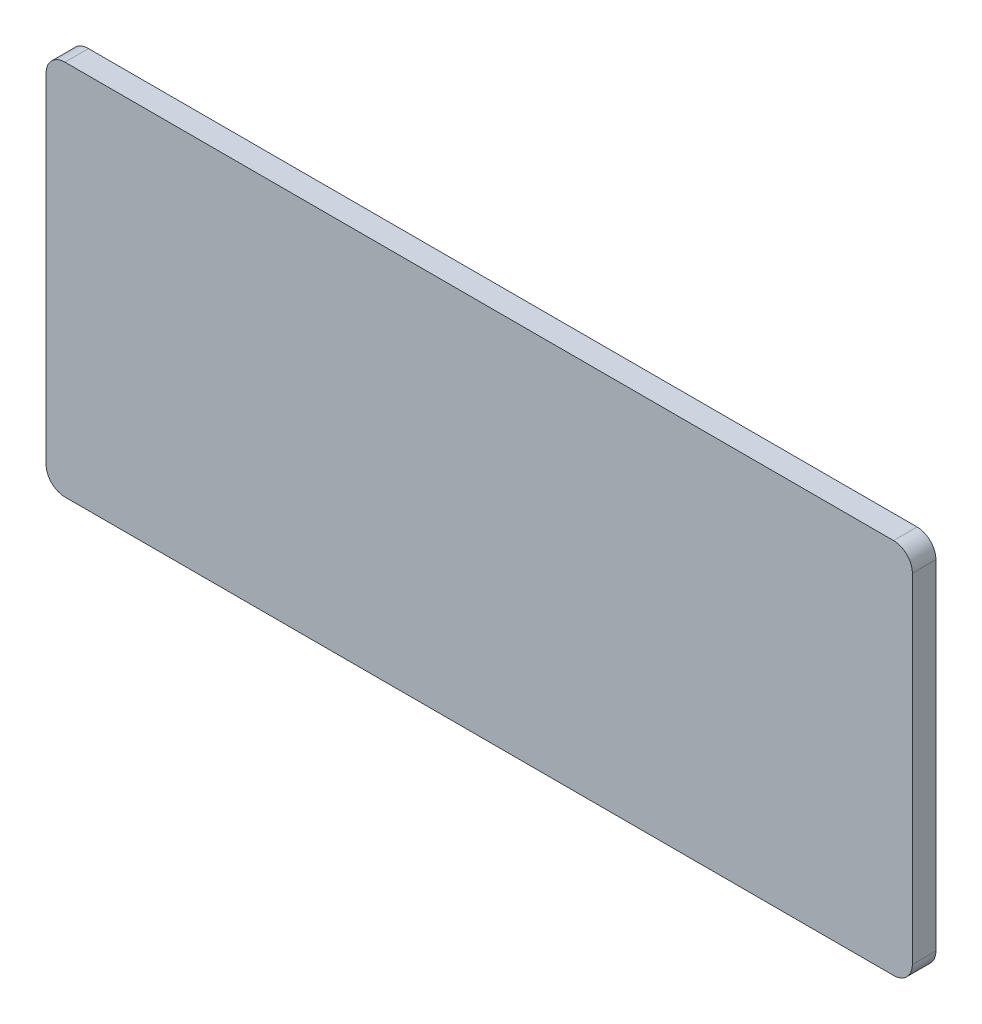
from build123d import *

# Parameters (mm, degrees)
SKETCH1_W           = 116.84
SKETCH1_H           = 50.8
BOSS_EXTRUDE1_DEPTH = 3.175
FILLET1_R           = 2.54


with BuildPart() as part:
    # Sketch1 → Boss-Extrude1 (new body)
    with BuildSketch(Plane.XY):
        Rectangle(SKETCH1_W, SKETCH1_H)
    extrude(amount=BOSS_EXTRUDE1_DEPTH)

    # Fillet1
    fillet1_edges = [part.edges().sort_by_distance(p)[0] for p in [
        (-58.42, -25.4, 1.5875),
        (-58.42, 25.4, 1.5875),
        (58.42, -25.4, 1.5875),
        (58.42, 25.4, 1.5875),
    ]]
    fillet(fillet1_edges, radius=FILLET1_R)


solid = part.part
